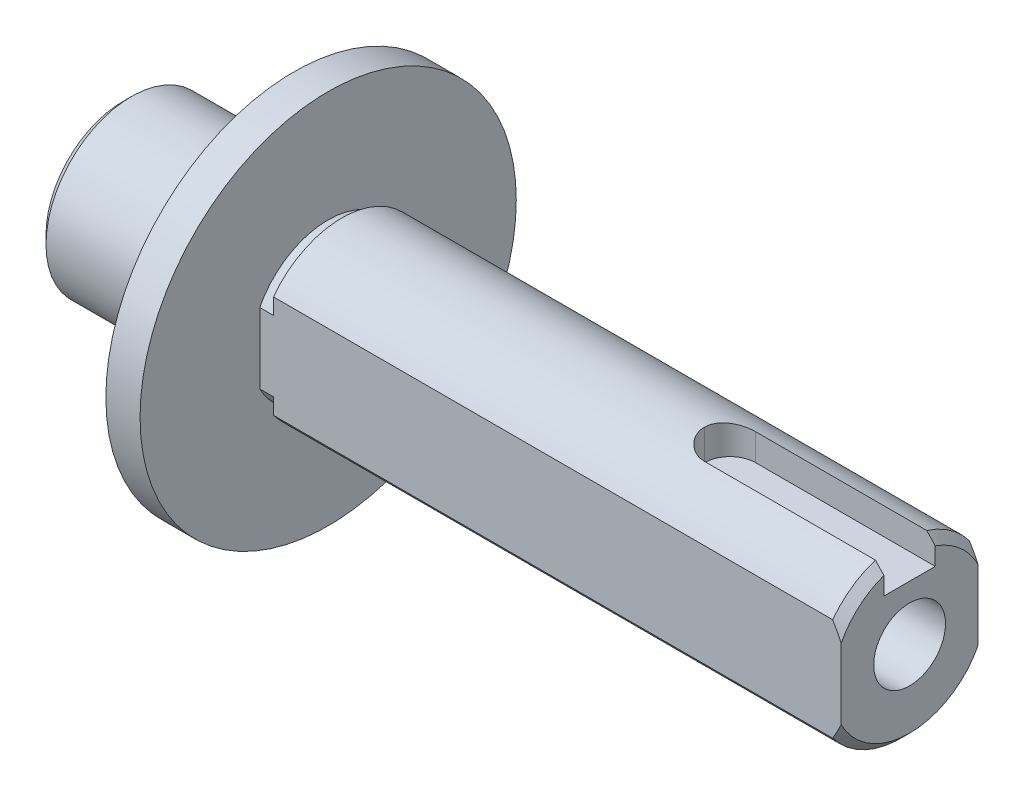
from build123d import *

# Parameters (mm, degrees)
SKETCH1_R                        = 5
BOSS_EXTRUDE1_DEPTH              = 34
CHAMFER1_SIZE                    = 0.5
SKETCH2_R                        = 11
BOSS_EXTRUDE2_DEPTH              = 2
SKETCH3_W                        = 3
SKETCH3_H                        = 1.8
CUT_EXTRUDE1_DEPTH               = 12
FILLET1_R                        = 1.5
BOSS_EXTRUDE3_START              = 10
SKETCH4_R                        = 5
BOSS_EXTRUDE3_DEPTH              = 10
SKETCH6_W                        = 0.8
SKETCH6_H                        = 0.5
CHAMFER2_SIZE                    = 0.5
CUT_EXTRUDE2_DEPTH               = 38.389838192
TAP_DRILL_FOR_M4_HELICOIL1_D     = 4.2
TAP_DRILL_FOR_M4_HELICOIL1_DEPTH = 20
TAP_DRILL_FOR_M4_HELICOIL1_TIP   = 1.2618073


with BuildPart() as part:
    # Sketch1 → Boss-Extrude1 (new body)
    with BuildSketch(Plane(origin=(0, 0, 0), x_dir=(0, 0, -1), z_dir=(1, 0, 0))):
        Circle(SKETCH1_R)
    extrude(amount=BOSS_EXTRUDE1_DEPTH)

    # Chamfer1
    chamfer1_edges = [part.edges().sort_by_distance(p)[0] for p in [
        (34, 0, 5),
    ]]
    chamfer(chamfer1_edges, length=CHAMFER1_SIZE)

    # Sketch2 → Boss-Extrude2 (add)
    with BuildSketch(Plane.ZY):
        Circle(SKETCH2_R)
    extrude(amount=BOSS_EXTRUDE2_DEPTH)

    # Sketch3 → Cut-Extrude1 (cut)
    with BuildSketch(Plane(origin=(34, 0, 0), x_dir=(0, 0, -1), z_dir=(1, 0, 0))):
        with Locations((0, 4.1)):
            Rectangle(SKETCH3_W, SKETCH3_H)
    extrude(amount=-CUT_EXTRUDE1_DEPTH, mode=Mode.SUBTRACT)

    # Fillet1
    fillet1_edges = [part.edges().sort_by_distance(p)[0] for p in [
        (22, 3.984848004, 1.5),
        (22, 3.984848004, -1.5),
    ]]
    fillet(fillet1_edges, radius=FILLET1_R - 0.0001)  # a hair under: the kernel refuses the full size

    # Sketch4 → Boss-Extrude3 (add)
    with BuildSketch(Plane.ZY.offset(2).offset(BOSS_EXTRUDE3_START)):
        with Locations(Location((0, 0, 0), (0, 0, 72.542396876))):
            Circle(SKETCH4_R)
    extrude(amount=-BOSS_EXTRUDE3_DEPTH)

    # Sketch6 → Cut-Revolve1 (revolve, cut)
    with BuildSketch(Plane.XY, mode=Mode.PRIVATE) as cut_revolve1_sk:
        with Locations((-2.4, 4.75)):
            Rectangle(SKETCH6_W, SKETCH6_H)
        with Locations((0.4, 4.75)):
            Rectangle(SKETCH6_W, SKETCH6_H)
    revolve(cut_revolve1_sk.sketch.rotate(Axis((0, 0, 0), (1, 0, 0)), 90), axis=Axis((0, 0, 0), (1, 0, 0)), mode=Mode.SUBTRACT)

    # Chamfer2
    chamfer2_edges = [part.edges().sort_by_distance(p)[0] for p in [
        (-12, -4.769696007, -1.5),
    ]]
    chamfer(chamfer2_edges, length=CHAMFER2_SIZE)

    # Sketch7 → Cut-Extrude2 (cut, through all)
    with BuildSketch(Plane(origin=(0, 0, 0), x_dir=(0, 0, -1), z_dir=(1, 0, 0))):
        with BuildLine():
            Line((-4, 3), (-4, -3))
            ThreePointArc((-4, -3), (-5, 0), (-4, 3))
        make_face()
        with BuildLine():
            Line((4, 3), (4, -3))
            ThreePointArc((4, -3), (5, 0), (4, 3))
        make_face()
    extrude(amount=CUT_EXTRUDE2_DEPTH, mode=Mode.SUBTRACT)

    # Tap Drill for M4 Helicoil1
    with Locations(Plane(origin=(34, 0, 0), x_dir=(0, 0, -1), z_dir=(1, 0, 0))):
        with Locations((0, 0)):
            Hole(TAP_DRILL_FOR_M4_HELICOIL1_D / 2, depth=TAP_DRILL_FOR_M4_HELICOIL1_DEPTH)
            with Locations((0, 0, -(TAP_DRILL_FOR_M4_HELICOIL1_DEPTH + TAP_DRILL_FOR_M4_HELICOIL1_TIP / 2))):  # 118° drill point
                Cone(0, TAP_DRILL_FOR_M4_HELICOIL1_D / 2, TAP_DRILL_FOR_M4_HELICOIL1_TIP, mode=Mode.SUBTRACT)


solid = part.part
